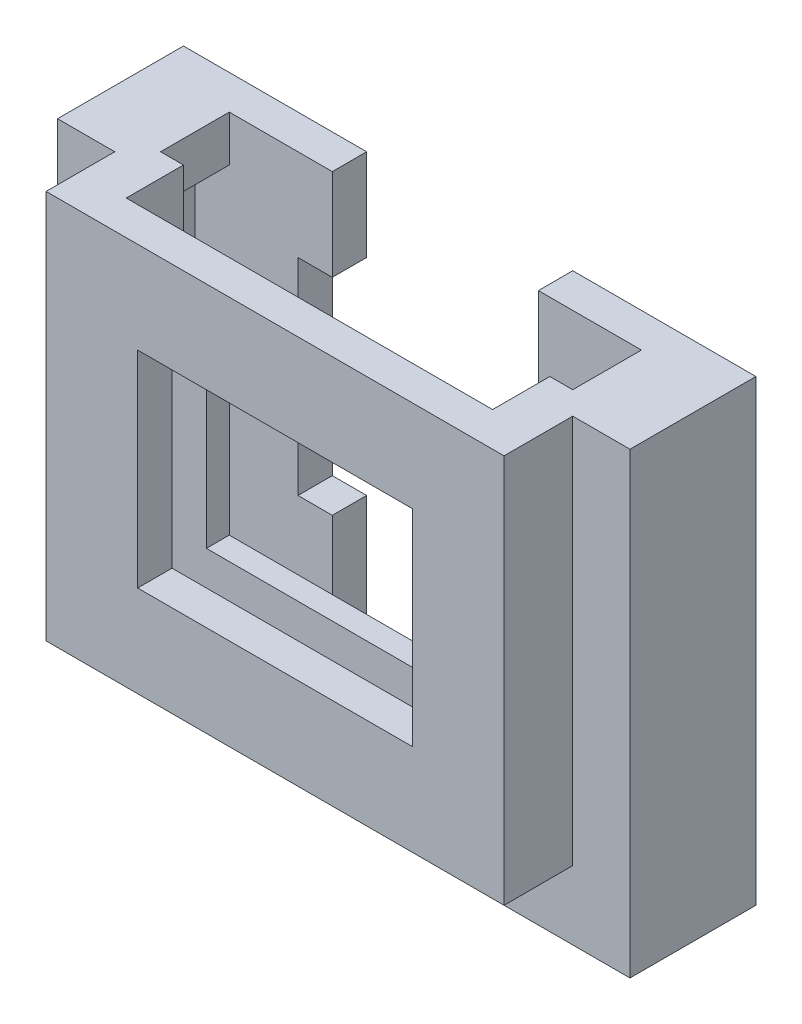
from build123d import *

# Parameters (mm, degrees)
RESSALTO_EXTRUS_O1_DEPTH  = 1.5
RESSALTO_EXTRUS_O2_DEPTH  = 3
ESBO_O2_W                 = 1
ESBO_O2_H                 = 15
ESBO_O2_H_2               = 2
RESSALTO_EXTRUS_O3_DEPTH  = 1
ESBO_O2_4_W               = 1
ESBO_O2_4_H               = 2
ESBO_O2_4_H_2             = 15
RESSALTO_EXTRUS_O4_DEPTH  = 2.5
ESBO_O3_W                 = 20
ESBO_O3_H                 = 17
RESSALTO_EXTRUS_O5_DEPTH  = 1.5
CORTE_EXTRUS_O1_START     = -2
CORTE_EXTRUS_O1_OUTLINE_W = 12
CORTE_EXTRUS_O1_OUTLINE_H = 1.5
CORTE_EXTRUS_O1_DEPTH     = 2
ESBO_O5_W                 = 9
ESBO_O5_H                 = 2
ESBO_O5_H_2               = 16
CORTE_EXTRUS_O2_DEPTH     = 2.5
ESBO_O6_W                 = 12
ESBO_O6_H                 = 9
CORTE_EXTRUS_O3_DEPTH     = 9.5


# Read off the part's stored shape, not the designer's step: Corte-extrusão1
with BuildPart() as part:
    # Esboço1 → Ressalto-extrusão1 (new body)
    with BuildSketch(Plane.XY):
        Polygon((12.5, 10), (-12.5, 10), (-12.5, -10), (-10.5, -10), (-10.5, -8), (10.5, -8), (10.5, -10), (12.5, -10), align=None)
    extrude(amount=-RESSALTO_EXTRUS_O1_DEPTH)

    # Esboço1<3> → Ressalto-extrusão2 (add)
    with BuildSketch(Plane.XY):
        Polygon((-10.5, 8), (-9, 8), (-9, 10), (-12.5, 10), (-12.5, -10), (-10.5, -10), (-10.5, -8), align=None)
        Polygon((9, 10), (9, 8), (10.5, 8), (10.5, -8), (10.5, -10), (12.5, -10), (12.5, 10), align=None)
    extrude(amount=RESSALTO_EXTRUS_O2_DEPTH)

    # Esboço2 → Ressalto-extrusão3 (add)
    with BuildSketch(Plane.XY.offset(3)):
        Polygon((-10, 10), (-12.5, 10), (-12.5, -10), (-10.5, -10), (-10.5, 8), (-10, 8), align=None)
        Polygon((-10.5, 8), (-10.5, -10), (12.5, -10), (12.5, 10), (10, 10), (10, 8), (10, -7), (9, -7), (0, -7), (-9, -7), (-10, -7), (-10, 8), align=None)
        with Locations((-9.5, 0.5)):
            Rectangle(ESBO_O2_W, ESBO_O2_H)
        with Locations((-9.5, 9)):
            Rectangle(ESBO_O2_W, ESBO_O2_H_2)
        Polygon((-8, 8), (-9, 8), (-9, -7), (0, -7), (9, -7), (9, 8), (8, 8), (8, 7), (8, -5), (0, -5), (-8, -5), (-8, 7), align=None)
        with Locations((-8.5, 9)):
            Rectangle(ESBO_O2_W, ESBO_O2_H_2)
        with Locations((8.5, 9)):
            Rectangle(ESBO_O2_W, ESBO_O2_H_2)
        with Locations((9.5, 9)):
            Rectangle(ESBO_O2_W, ESBO_O2_H_2)
        with Locations((9.5, 0.5)):
            Rectangle(ESBO_O2_W, ESBO_O2_H)
        Polygon((8, -5), (8, 7), (0, 7), (0, 0), (0, -5), align=None)
        Polygon((0, 7), (-8, 7), (-8, -5), (0, -5), (0, 0), align=None)
    extrude(amount=RESSALTO_EXTRUS_O3_DEPTH)

    # Esboço2<4> → Ressalto-extrusão4 (add)
    with BuildSketch(Plane.XY.offset(3)):
        with Locations((-8.5, 9)):
            Rectangle(ESBO_O2_4_W, ESBO_O2_4_H)
        with Locations((-9.5, 9)):
            Rectangle(ESBO_O2_4_W, ESBO_O2_4_H)
        with Locations((-9.5, 0.5)):
            Rectangle(ESBO_O2_4_W, ESBO_O2_4_H_2)
        Polygon((-8, 8), (-9, 8), (-9, -7), (0, -7), (9, -7), (9, 8), (8, 8), (8, 7), (8, -5), (0, -5), (-8, -5), (-8, 7), align=None)
        with Locations((9.5, 0.5)):
            Rectangle(ESBO_O2_4_W, ESBO_O2_4_H_2)
        with Locations((8.5, 9)):
            Rectangle(ESBO_O2_4_W, ESBO_O2_4_H)
        with Locations((9.5, 9)):
            Rectangle(ESBO_O2_4_W, ESBO_O2_4_H)
    extrude(amount=RESSALTO_EXTRUS_O4_DEPTH)

    # Esboço3 → Ressalto-extrusão5 (add)
    with BuildSketch(Plane.XY.offset(5.5)):
        with Locations((0, 1.5)):
            Rectangle(ESBO_O3_W, ESBO_O3_H)
    extrude(amount=RESSALTO_EXTRUS_O5_DEPTH)

    # Corte-extrusão1 outline → Corte-extrusão1 (cut)
    with BuildSketch(Plane.XZ.offset(7).offset(CORTE_EXTRUS_O1_START)):
        with Locations((0, 4.75)):
            Rectangle(CORTE_EXTRUS_O1_OUTLINE_W, CORTE_EXTRUS_O1_OUTLINE_H)
    extrude(amount=CORTE_EXTRUS_O1_DEPTH, mode=Mode.SUBTRACT)

    # Esboço5 → Corte-extrusão2 (cut)
    with BuildSketch(Plane(origin=(0, 0, -1.5), x_dir=(-1, 0, 0), z_dir=(0, 0, -1))):
        with Locations((0, 9)):
            Rectangle(ESBO_O5_W, ESBO_O5_H)
        Rectangle(ESBO_O5_W, ESBO_O5_H_2)
    extrude(amount=-CORTE_EXTRUS_O2_DEPTH, mode=Mode.SUBTRACT)

    # Esboço6 → Corte-extrusão3 (cut)
    with BuildSketch(Plane.XY.offset(7)):
        with Locations((0, 1.5)):
            Rectangle(ESBO_O6_W, ESBO_O6_H)
    extrude(amount=-CORTE_EXTRUS_O3_DEPTH, mode=Mode.SUBTRACT)


solid = part.part
